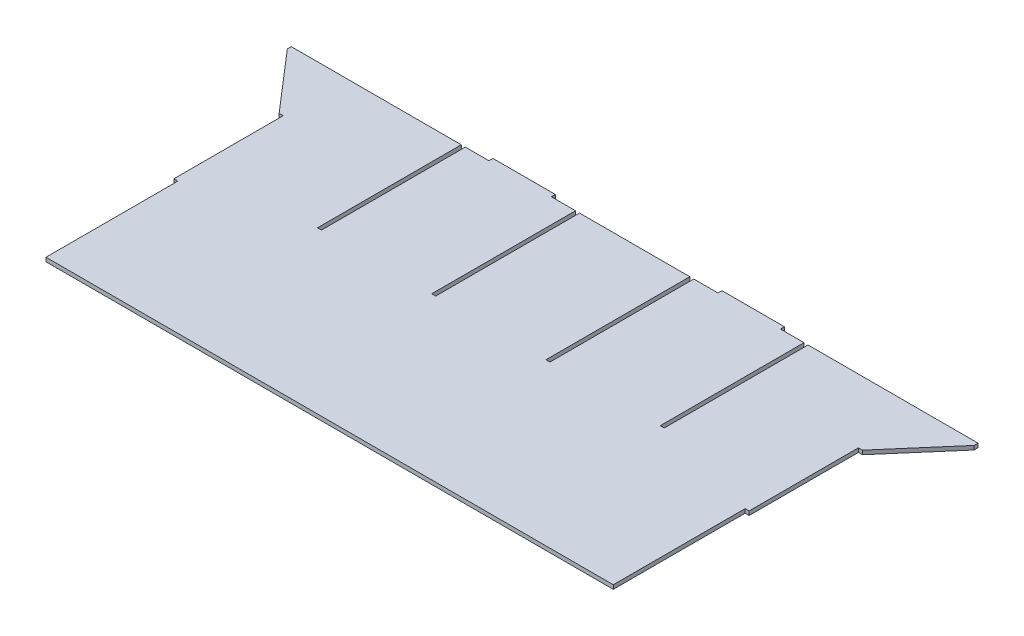
from build123d import *

# Parameters (mm, degrees)
SKETCH1_W           = 457.2020066
SKETCH1_H           = 3.175
BOSS_EXTRUDE1_DEPTH = 242.425000036
SKETCH2_W           = 3.175
SKETCH2_H           = 114.3
CUT_EXTRUDE1_DEPTH  = 334.224218774
LPATTERN1_COUNT     = 4
LPATTERN1_PITCH     = 90.807
SKETCH3_W           = 49.658811606
SKETCH3_H           = 3.175
BOSS_EXTRUDE2_DEPTH = 3.175
BOSS_EXTRUDE3_DEPTH = 3.175
SKETCH5_W           = 3.175
SKETCH5_H           = 104.775
CUT_EXTRUDE2_DEPTH  = 3.175


with BuildPart() as part:
    # Sketch1 → Boss-Extrude1 (new body)
    with BuildSketch(Plane.XY):
        Rectangle(SKETCH1_W, SKETCH1_H)
    extrude(amount=BOSS_EXTRUDE1_DEPTH)

    # Sketch2 → Cut-Extrude1 (cut, through all)
    with BuildSketch(Plane(origin=(0, 1.5875, 0), x_dir=(1, 0, 0), z_dir=(0, 1, 0))):
        with Locations((136.2085033, -57.15)):
            Rectangle(SKETCH2_W, SKETCH2_H)
    cut_extrude1 = extrude(amount=-CUT_EXTRUDE1_DEPTH, mode=Mode.SUBTRACT)

    # LPattern1: Cut-Extrude1 ×4
    with Locations(*[(-i * LPATTERN1_PITCH, 0, 0) for i in range(1, LPATTERN1_COUNT)]):
        add(cut_extrude1, mode=Mode.SUBTRACT)

    # Sketch3 → Boss-Extrude2 (add)
    with BuildSketch(Plane(origin=(0, 0, 0), x_dir=(-1, 0, 0), z_dir=(0, 0, -1))):
        with Locations((-91.020094169, 0)):
            Rectangle(SKETCH3_W, SKETCH3_H)
        with Locations((91.020094169, 0)):
            Rectangle(SKETCH3_W, SKETCH3_H)
    extrude(amount=BOSS_EXTRUDE2_DEPTH)

    # Sketch4 → Boss-Extrude3 (add)
    with BuildSketch(Plane.XZ.offset(1.5875)):
        Polygon((-228.6010033, 0), (-272.8760033, 0), (-272.8760033, 3.175), (-231.7760033, 50.8), (-228.6010033, 50.8), align=None)
    boss_extrude3 = extrude(amount=-BOSS_EXTRUDE3_DEPTH)

    # Mirror1: Boss-Extrude3 across plane
    add(boss_extrude3.mirror(Plane(origin=(0, 0, 0), x_dir=(0, 0, 1), z_dir=(1, 0, 0))))

    # Sketch5 → Cut-Extrude2 (cut)
    with BuildSketch(Plane.XZ.offset(1.5875)):
        with Locations((-227.0135033, 190.037500036)):
            Rectangle(SKETCH5_W, SKETCH5_H)
    cut_extrude2 = extrude(amount=-CUT_EXTRUDE2_DEPTH, mode=Mode.SUBTRACT)

    # Mirror2: Cut-Extrude2 across plane
    add(cut_extrude2.mirror(Plane(origin=(0, 0, 0), x_dir=(0, 0, 1), z_dir=(1, 0, 0))), mode=Mode.SUBTRACT)


solid = part.part
